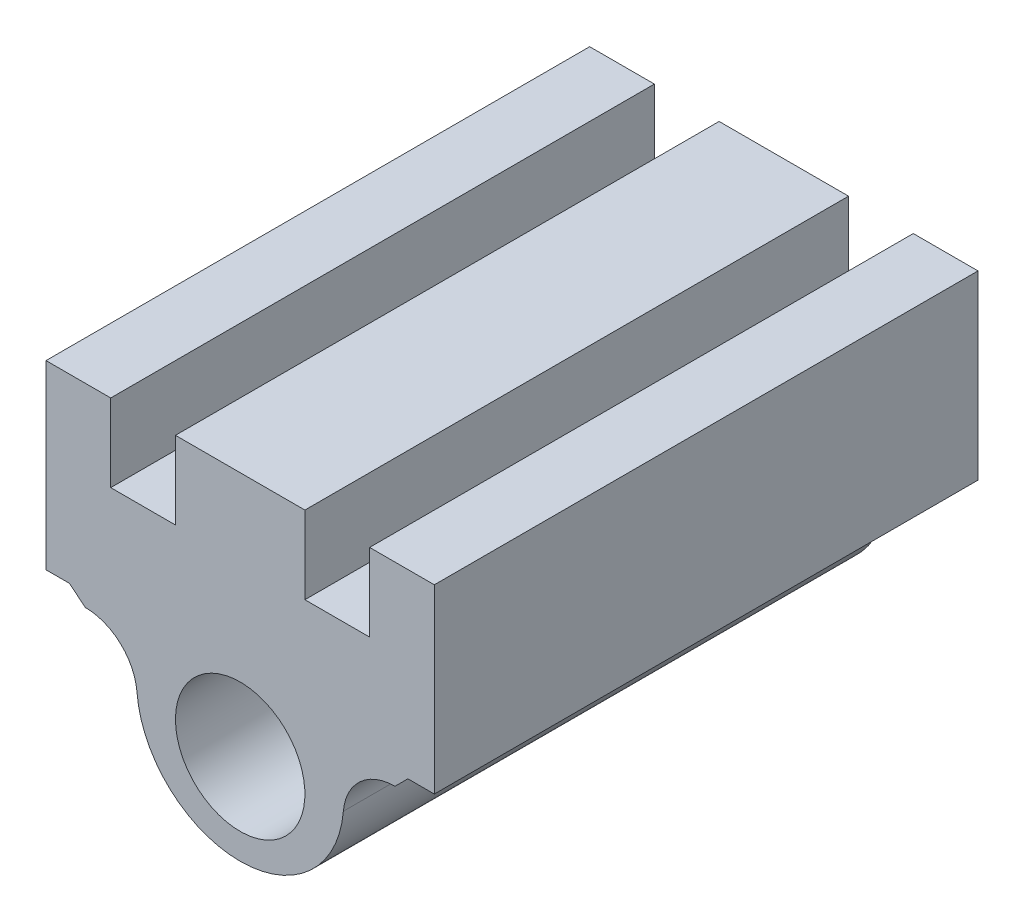
from build123d import *

# Parameters (mm, degrees)
SKETCH1_W           = 60
SKETCH1_H           = 42
BOSS_EXTRUDE1_DEPTH = 8
SKETCH3_W           = 10
SKETCH3_H           = 42
BOSS_EXTRUDE5_DEPTH = 6
SKETCH5_W           = 14
SKETCH5_H           = 42
BOSS_EXTRUDE6_DEPTH = 11
SKETCH6_R           = 5
CUT_EXTRUDE1_DEPTH  = 75.565407529
FILLET1_R           = 7
FILLET2_R           = 5
FILLET3_R           = 5
BOSS_EXTRUDE7_DEPTH = 42
SKETCH9_W           = 5
SKETCH9_H           = 42
BOSS_EXTRUDE8_DEPTH = 6
SKETCH11_W          = 15
SKETCH11_H          = 42
CUT_EXTRUDE2_DEPTH  = 76.921011584


with BuildPart() as part:
    # Sketch1 → Boss-Extrude1 (new body)
    with BuildSketch(Plane(origin=(0, 0, 0), x_dir=(1, 0, 0), z_dir=(0, 1, 0))):
        with Locations((30, 21)):
            Rectangle(SKETCH1_W, SKETCH1_H)
    extrude(amount=BOSS_EXTRUDE1_DEPTH)

    # Sketch3 → Boss-Extrude5 (add)
    with BuildSketch(Plane(origin=(0, 8, 0), x_dir=(1, 0, 0), z_dir=(0, 1, 0))):
        with Locations((30, 21)):
            Rectangle(SKETCH3_W, SKETCH3_H)
    extrude(amount=BOSS_EXTRUDE5_DEPTH)

    # Sketch5 → Boss-Extrude6 (add)
    with BuildSketch(Plane.XZ):
        with Locations((30, -21)):
            Rectangle(SKETCH5_W, SKETCH5_H)
    extrude(amount=BOSS_EXTRUDE6_DEPTH)

    # Sketch6 → Cut-Extrude1 (cut, through all)
    with BuildSketch(Plane(origin=(0, 0, -42), x_dir=(-1, 0, 0), z_dir=(0, 0, -1))):
        with Locations((-30, -5)):
            Circle(SKETCH6_R)
    extrude(amount=-CUT_EXTRUDE1_DEPTH, mode=Mode.SUBTRACT)

    # Fillet1
    fillet1_edges = [part.edges().sort_by_distance(p)[0] for p in [
        (23, -11, -21),
        (37, -11, -21),
    ]]
    fillet(fillet1_edges, radius=FILLET1_R - 0.0001)  # a hair under: the kernel refuses the full size

    # Fillet2
    fillet2_edges = [part.edges().sort_by_distance(p)[0] for p in [
        (23, 0, -21),
    ]]
    fillet(fillet2_edges, radius=FILLET2_R)

    # Fillet3
    fillet3_edges = [part.edges().sort_by_distance(p)[0] for p in [
        (37, 0, -21),
    ]]
    fillet(fillet3_edges, radius=FILLET3_R)

    # Sketch8 → Boss-Extrude7 (add)
    with BuildSketch(Plane(origin=(0, 0, -42), x_dir=(-1, 0, 0), z_dir=(0, 0, -1))):
        with BuildLine():
            Line((-41.958260743, -1), (-42.958260743, 0))
            Line((-42.958260743, 0), (-41.958260743, 0))
            ThreePointArc((-41.958260743, 0), (-38.573244741, -1.320099639), (-36.9756521, -4.583333333))
            ThreePointArc((-36.9756521, -4.583333333), (-34.739022403, -9.151860505), (-30, -11))
            ThreePointArc((-30, -11), (-25.260977597, -9.151860505), (-23.0243479, -4.583333333))
            ThreePointArc((-23.0243479, -4.583333333), (-21.426755259, -1.320099639), (-18.041739257, 0))
            Line((-18.041739257, 0), (-16.803044796, 0))
            Line((-16.803044796, 0), (-18.041739257, -1))
            ThreePointArc((-18.041739257, -1), (-20.749752058, -2.056079711), (-22.027826171, -4.666666667))
            ThreePointArc((-22.027826171, -4.666666667), (-24.583974397, -9.887840578), (-30, -12))
            ThreePointArc((-30, -12), (-35.416025603, -9.887840578), (-37.972173829, -4.666666667))
            ThreePointArc((-37.972173829, -4.666666667), (-39.250247942, -2.056079711), (-41.958260743, -1))
        make_face()
    extrude(amount=-BOSS_EXTRUDE7_DEPTH)

    # Sketch9 → Boss-Extrude8 (add)
    with BuildSketch(Plane(origin=(0, 8, 0), x_dir=(1, 0, 0), z_dir=(0, 1, 0))):
        with Locations((42.5, 21)):
            Rectangle(SKETCH9_W, SKETCH9_H)
        with Locations((17.5, 21)):
            Rectangle(SKETCH9_W, SKETCH9_H)
    extrude(amount=BOSS_EXTRUDE8_DEPTH)

    # Sketch11 → Cut-Extrude2 (cut, through all)
    with BuildSketch(Plane(origin=(0, 8, 0), x_dir=(1, 0, 0), z_dir=(0, 1, 0))):
        with Locations((52.5, 21)):
            Rectangle(SKETCH11_W, SKETCH11_H)
        with Locations((7.5, 21)):
            Rectangle(SKETCH11_W, SKETCH11_H)
    extrude(amount=-CUT_EXTRUDE2_DEPTH, mode=Mode.SUBTRACT)


solid = part.part
